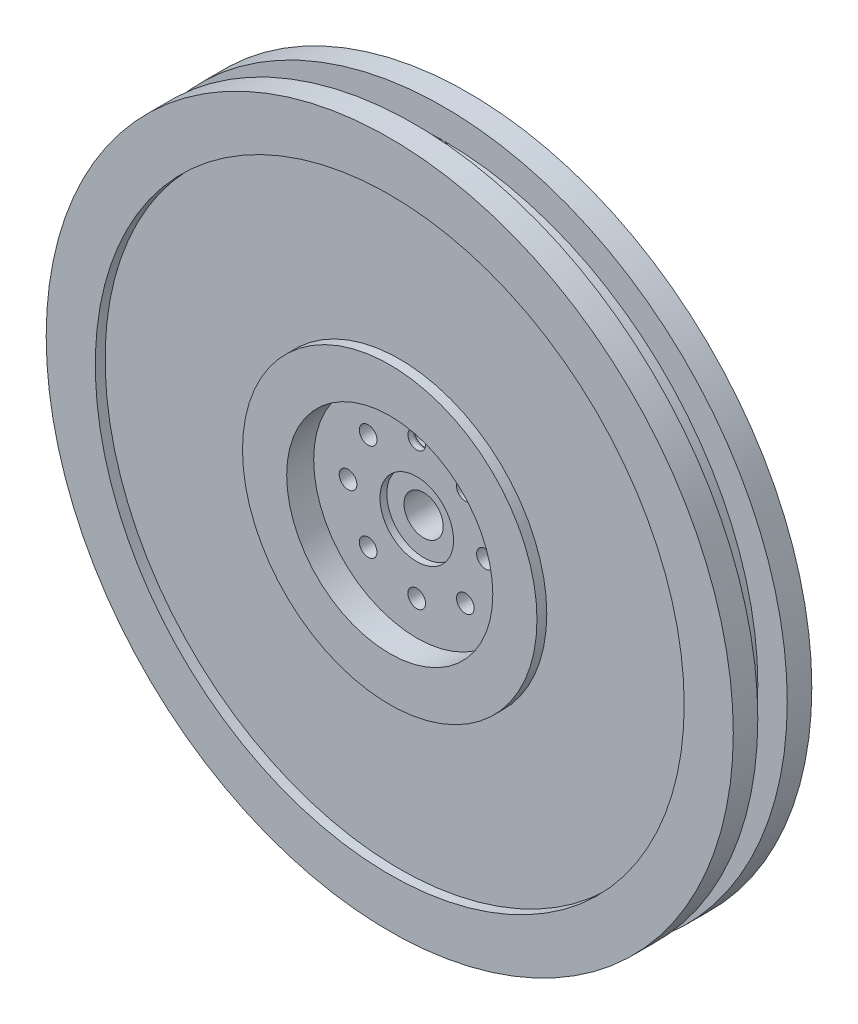
from build123d import *
from build123d.topology import SkipClean

# Parameters (mm, degrees)
SKETCH4_R              = 10.5
CUT_EXTRUDE2_DEPTH     = 2.75
SKETCH5_R              = 3.75
CUT_EXTRUDE3_DEPTH     = 0.7
SKETCH6_R              = 0.9
CUT_EXTRUDE4_DEPTH     = 50.775119287
SKETCH11_R             = 2
CUT_EXTRUDE8_DEPTH     = 50.70616159
CUT_EXTRUDE9_START     = -25
CUT_EXTRUDE9_OUTLINE_R = 1
CUT_EXTRUDE9_DEPTH     = 26
SKETCH18_R             = 30
CUT_EXTRUDE12_DEPTH    = 1
CUT_EXTRUDE13_START    = -1
SKETCH19_R             = 30
SKETCH19_R_2           = 15
CUT_EXTRUDE13_DEPTH    = 1


with BuildPart() as part:
    # Sketch2 → Revolve1 (revolve)
    with BuildSketch(Plane(origin=(0, 0, 0), x_dir=(1, 0, 0), z_dir=(0, 1, 0))):
        Polygon((0, 0), (35, 0), (35, 2.5), (32, 2.5), (32, 5.5), (35, 5.5), (35, 8), (0, 8), align=None)
    revolve(axis=Axis((0, 0, 27.772111005), (0, 0, -1)))

    # Sketch4 → Cut-Extrude2 (cut)
    with BuildSketch(Plane.XY):
        Circle(SKETCH4_R)
    extrude(amount=-CUT_EXTRUDE2_DEPTH, mode=Mode.SUBTRACT)

    # Sketch5 → Cut-Extrude3 (cut)
    with BuildSketch(Plane.XY.offset(-2.75)):
        Circle(SKETCH5_R)
    extrude(amount=-CUT_EXTRUDE3_DEPTH, mode=Mode.SUBTRACT)

    # Sketch6 → Cut-Extrude4 (cut, through all)
    with BuildSketch(Plane.XY.offset(-2.75)):
        with Locations((0, 7)):
            Circle(SKETCH6_R)
        with Locations((4.949747468, 4.949747468)):
            Circle(SKETCH6_R)
        with Locations((7, 0)):
            Circle(SKETCH6_R)
        with Locations((4.949747468, -4.949747468)):
            Circle(SKETCH6_R)
        with Locations((0, -7)):
            Circle(SKETCH6_R)
        with Locations((-4.949747468, -4.949747468)):
            Circle(SKETCH6_R)
        with Locations((-7, 0)):
            Circle(SKETCH6_R)
        with Locations((-4.949747468, 4.949747468)):
            Circle(SKETCH6_R)
    extrude(amount=-CUT_EXTRUDE4_DEPTH, mode=Mode.SUBTRACT)

    # Sketch11 → Cut-Extrude8 (cut, through all)
    with BuildSketch(Plane.XY.offset(-3.45)):
        Circle(SKETCH11_R)
    extrude(amount=-CUT_EXTRUDE8_DEPTH, mode=Mode.SUBTRACT)

    # Cut-Extrude9: read off the stored shape, not the designer's step
    # Cut-Extrude9 outline → Cut-Extrude9 (cut)
    with BuildSketch(Plane(origin=(0, 32, 0), x_dir=(1, 0, 0), z_dir=(0, 1, 0)).offset(CUT_EXTRUDE9_START)):
        with Locations((0, 4.5)):
            Circle(CUT_EXTRUDE9_OUTLINE_R)
    extrude(amount=CUT_EXTRUDE9_DEPTH, mode=Mode.SUBTRACT)

    # Fillet4: read off the stored shape, not the designer's step
    # Fillet4 outline → Fillet4 (revolve, cut)
    with SkipClean():  # the faces are left unmerged after this step: merging them gives an invalid solid
        with BuildSketch(Plane.XZ.offset(-7)):
            with BuildLine():
                Line((1, -5.5), (1, -3.5))
                ThreePointArc((1, -3.5), (0.926138721, -3.398867689), (0.9, -3.276393202))
                Line((0.9, -3.276393202), (0.9, -5.723606798))
                ThreePointArc((0.9, -5.723606798), (0.926138721, -5.601132311), (1, -5.5))
            make_face()
        revolve(axis=Axis((0, 7, 0), (0, 0, 1)), mode=Mode.SUBTRACT)

    # Sketch18 → Cut-Extrude12 (cut)
    with SkipClean():  # the faces are left unmerged after this step: merging them gives an invalid solid
        with BuildSketch(Plane(origin=(0, 0, -8), x_dir=(-1, 0, 0), z_dir=(0, 0, -1))):
            Circle(SKETCH18_R)
        extrude(amount=-CUT_EXTRUDE12_DEPTH, mode=Mode.SUBTRACT)

    # Sketch19 → Cut-Extrude13 (cut)
    with SkipClean():  # the faces are left unmerged after this step: merging them gives an invalid solid
        with BuildSketch(Plane.XY.offset(CUT_EXTRUDE13_START)):
            with Locations(Location((0, 0, 0), (0, 0, 180))):
                Circle(SKETCH19_R)
            Circle(SKETCH19_R_2, mode=Mode.SUBTRACT)
        extrude(amount=CUT_EXTRUDE13_DEPTH, mode=Mode.SUBTRACT)


solid = part.part
